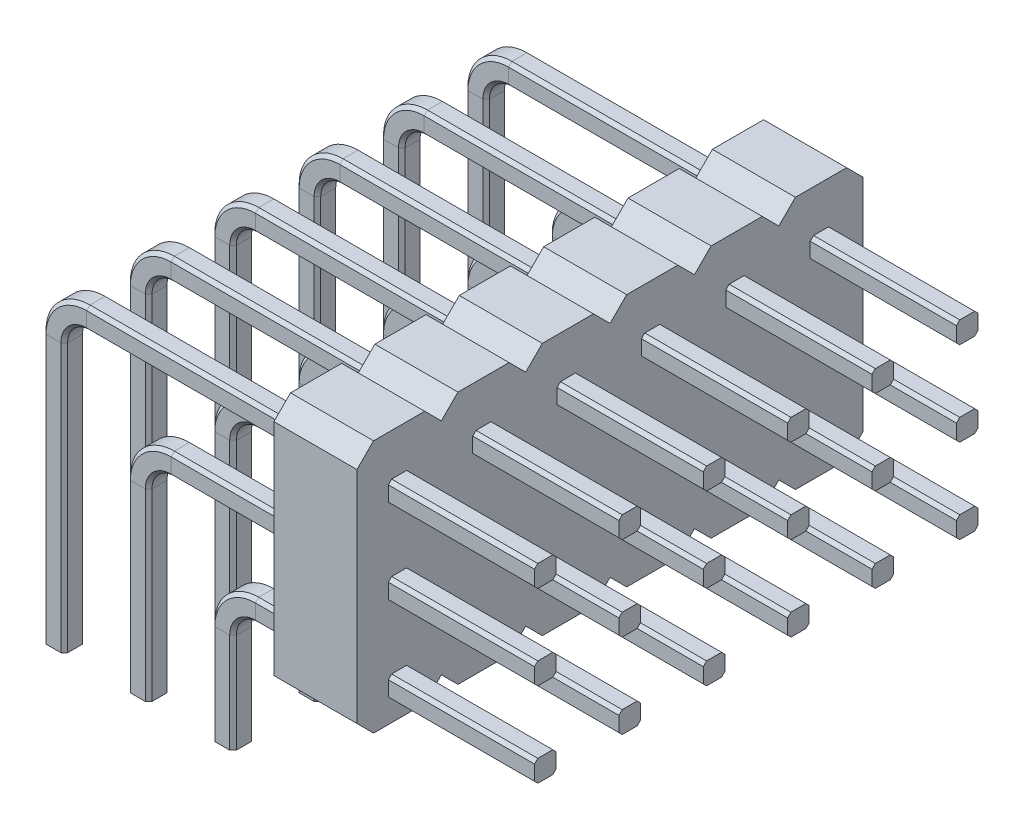
from build123d import *

# Parameters (mm, degrees)
BOSS_EXTRUDE1_DEPTH = 2.5
LPATTERN1_COUNT     = 6
LPATTERN1_PITCH     = 2.54


with BuildPart() as part:
    # Sweep1: sweep along a path in Sketch2
    with BuildLine(Plane.XY) as sweep1_path:
        Line((5.08, 0), (5.08, 3))
        ThreePointArc((5.08, 3), (5.372893219, 3.707106781), (6.08, 4))
        Line((6.08, 4), (14.48, 4))
    # Sketch1 → Sweep1 (sweep)
    with BuildSketch(Plane(origin=(0, 0, 0), x_dir=(1, 0, 0), z_dir=(0, 1, 0))):
        Polygon((4.855, 0.325), (5.305, 0.325), (5.405, 0.225), (5.405, -0.225), (5.305, -0.325), (4.855, -0.325), (4.755, -0.225), (4.755, 0.225), align=None)
    sweep(path=sweep1_path.line)



with BuildPart() as body_2:
    # Sweep4: sweep along a path in Sketch2<4>
    with BuildLine(Plane.XY) as sweep4_path:
        Line((2.54, 0), (2.54, 5.54))
        ThreePointArc((2.54, 5.54), (2.832893219, 6.247106781), (3.54, 6.54))
        Line((3.54, 6.54), (14.48, 6.54))
    # Sketch1<4> → Sweep4 (sweep)
    with BuildSketch(Plane(origin=(0, 0, 0), x_dir=(1, 0, 0), z_dir=(0, 1, 0))):
        Polygon((2.315, 0.325), (2.765, 0.325), (2.865, 0.225), (2.865, -0.225), (2.765, -0.325), (2.315, -0.325), (2.215, -0.225), (2.215, 0.225), align=None)
    sweep(path=sweep4_path.line)


with BuildPart() as body_3:
    # Sweep5: sweep along a path in Sketch2<5>
    with BuildLine(Plane.XY) as sweep5_path:
        Line((0, 0), (0, 8.08))
        ThreePointArc((0, 8.08), (0.292893219, 8.787106781), (1, 9.08))
        Line((1, 9.08), (14.48, 9.08))
    # Sketch1<5> → Sweep5 (sweep)
    with BuildSketch(Plane(origin=(0, 0, 0), x_dir=(1, 0, 0), z_dir=(0, 1, 0))):
        Polygon((-0.325, 0.225), (-0.225, 0.325), (0.225, 0.325), (0.325, 0.225), (0.325, -0.225), (0.225, -0.325), (-0.225, -0.325), (-0.325, -0.225), align=None)
    sweep(path=sweep5_path.line)


with BuildPart() as part_1:
    add(part.part)

    add(body_2.part)  # Boss-Extrude1 merges body 2

    add(body_3.part)  # Boss-Extrude1 merges body 3
    # Sketch3 → Boss-Extrude1 (add)
    with BuildSketch(Plane(origin=(7.58, 0, 0), x_dir=(0, 0, -1), z_dir=(1, 0, 0))):
        Polygon((0.77, 3.055), (-0.77, 3.055), (-1.27, 3.555), (-1.27, 10.175), (-0.77, 10.675), (0.77, 10.675), (1.27, 10.175), (1.27, 3.555), align=None)
    extrude(amount=BOSS_EXTRUDE1_DEPTH)


with BuildPart() as lpattern1_1:
    # LPattern1: pattern copy
    add(part_1.part.moved(Location(Vector(0, 0, -1) * (1 * LPATTERN1_PITCH))))


with BuildPart() as lpattern1_2:
    # LPattern1: pattern copy
    add(part_1.part.moved(Location(Vector(0, 0, -1) * (2 * LPATTERN1_PITCH))))


with BuildPart() as lpattern1_3:
    # LPattern1: pattern copy
    add(part_1.part.moved(Location(Vector(0, 0, -1) * (3 * LPATTERN1_PITCH))))


with BuildPart() as lpattern1_4:
    # LPattern1: pattern copy
    add(part_1.part.moved(Location(Vector(0, 0, -1) * (4 * LPATTERN1_PITCH))))


with BuildPart() as lpattern1_5:
    # LPattern1: pattern copy
    add(part_1.part.moved(Location(Vector(0, 0, -1) * (5 * LPATTERN1_PITCH))))


with BuildPart() as part_2:
    add(part_1.part)

    # Combine1: union LPattern1_1, LPattern1_2, LPattern1_3, LPattern1_4, LPattern1_5
    add(lpattern1_1.part)
    add(lpattern1_2.part)
    add(lpattern1_3.part)
    add(lpattern1_4.part)
    add(lpattern1_5.part)


solid = part_2.part
